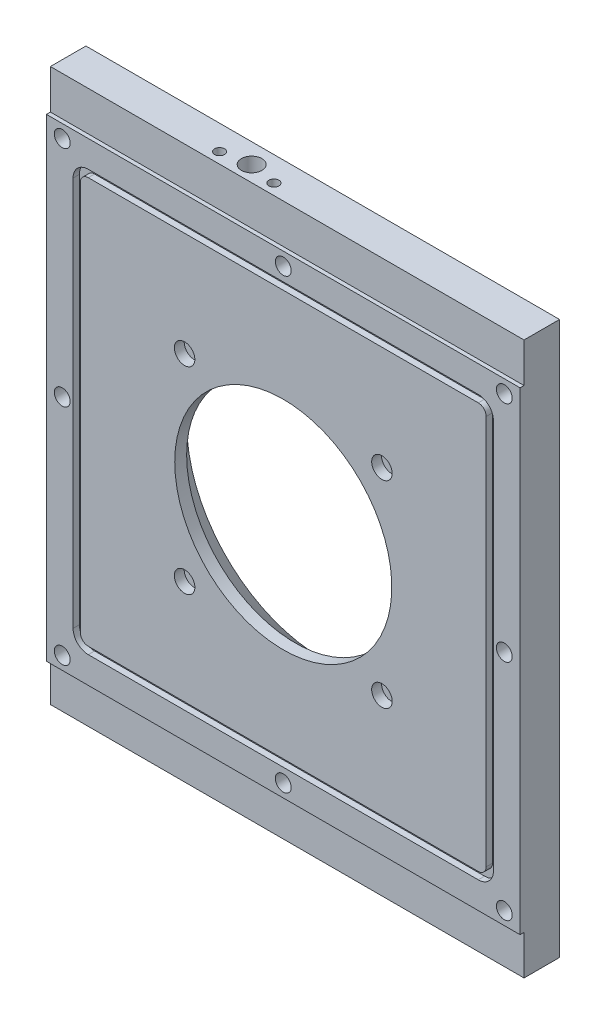
from build123d import *

# Parameters (mm, degrees)
SKETCH1_W                                       = 152.4
SKETCH1_H                                       = 177.8
BOSS_EXTRUDE1_DEPTH                             = 12.7
CUT_EXTRUDE5_START                              = -1.9304
CUT_EXTRUDE5_OUTLINE_W                          = 127
CUT_EXTRUDE5_OUTLINE_H                          = 127
CUT_EXTRUDE5_DEPTH                              = 1.9304
SKETCH7_W                                       = 102.9208
SKETCH7_H                                       = 102.9208
BOSS_EXTRUDE2_DEPTH                             = 1.9304
SKETCH9_W                                       = 34.925
SKETCH9_H                                       = 19.05
CBORE_FOR_10_SOCKET_HEAD_CAP_SCREW1_D           = 5.1054
CBORE_FOR_10_SOCKET_HEAD_CAP_SCREW1_CBORE_D     = 9.525
CBORE_FOR_10_SOCKET_HEAD_CAP_SCREW1_CBORE_DEPTH = 4.826
CBORE_FOR_10_SOCKET_HEAD_CAP_SCREW2_D           = 5.1054
CBORE_FOR_10_SOCKET_HEAD_CAP_SCREW2_CBORE_D     = 9.525
CBORE_FOR_10_SOCKET_HEAD_CAP_SCREW2_CBORE_DEPTH = 4.826
F_4_40_TAPPED_HOLE1_D                           = 2.2606
F_4_40_TAPPED_HOLE1_DEPTH                       = 7.5946
F_4_40_TAPPED_HOLE1_TIP                         = 0.679152758
SKETCH25_R                                      = 3.302
CUT_EXTRUDE7_DEPTH                              = 3.175
MIRROR2_COPY_1_SKETCH_R                         = 3.302
MIRROR2_COPY_1_DEPTH                            = 3.175
SKETCH26_W                                      = 152.4
SKETCH26_H                                      = 12.7
CUT_EXTRUDE8_DEPTH                              = 1.27
SKETCH30_R                                      = 1.6129
CUT_EXTRUDE12_DEPTH                             = 33.02
SKETCH31_R                                      = 3.302
CUT_EXTRUDE13_DEPTH                             = 40.64
CUT_EXTRUDE15_DEPTH                             = 2.032
SKETCH37_R                                      = 34.925
CUT_EXTRUDE18_DEPTH                             = 118.580133678
CHAMFER2_SIZE                                   = 8.8646
SKETCH38_W                                      = 127
SKETCH38_H                                      = 127
SKETCH38_W_2                                    = 102.9208
SKETCH38_H_2                                    = 102.9208
BOSS_EXTRUDE3_DEPTH                             = 1.9304


# Read off the part's stored shape, not the designer's step: Cut-Extrude5
with BuildPart() as part:
    # Sketch1 → Boss-Extrude1 (new body)
    with BuildSketch(Plane.XY.offset(12.7)):
        Rectangle(SKETCH1_W, SKETCH1_H)
    extrude(amount=-BOSS_EXTRUDE1_DEPTH)

    # Cut-Extrude5 outline → Cut-Extrude5 (cut)
    with BuildSketch(Plane.XY.offset(12.7).offset(CUT_EXTRUDE5_START)):
        Rectangle(CUT_EXTRUDE5_OUTLINE_W, CUT_EXTRUDE5_OUTLINE_H)
    extrude(amount=CUT_EXTRUDE5_DEPTH, mode=Mode.SUBTRACT)

    # Sketch7 → Boss-Extrude2 (add)
    with BuildSketch(Plane.XY.offset(10.7696)):
        Rectangle(SKETCH7_W, SKETCH7_H)
    extrude(amount=BOSS_EXTRUDE2_DEPTH)

    # Sketch9 → Cut-Revolve1 (revolve, cut)
    with BuildSketch(Plane.XZ, mode=Mode.PRIVATE) as cut_revolve1_sk:
        with Locations((17.4625, 11.4808)):
            Rectangle(SKETCH9_W, SKETCH9_H)
    revolve(cut_revolve1_sk.sketch.rotate(Axis((0, 0, 21.0058), (0, 0, -1)), 180), axis=Axis((0, 0, 21.0058), (0, 0, -1)), mode=Mode.SUBTRACT)

    # Sketch10 → Cut-Revolve2 (revolve, cut)
    with BuildSketch(Plane(origin=(-16.51, 0, 0), x_dir=(0, 0, -1), z_dir=(1, 0, 0))):
        Polygon((-6.35, 76.2), (-8.3165188, 76.2), (-7.718188123, 70.325851431), (-7.026590967, 70.325851431), (-7.026590967, 63.019039257), (-8.89, 62.746717258), (-8.89, 29.272053652), (-6.35, 29.272053652), align=None)
    revolve(axis=Axis((-16.51, 29.272053652, 6.35), (0, 1, 0)), mode=Mode.SUBTRACT)

    # CBORE for #10 Socket Head Cap Screw1 (through all)
    with Locations(Plane(origin=(0, 0, 0), x_dir=(-1, 0, 0), z_dir=(0, 0, -1))):
        with Locations((0, 72.009), (0, -72.009)):
            CounterBoreHole(CBORE_FOR_10_SOCKET_HEAD_CAP_SCREW1_D / 2, CBORE_FOR_10_SOCKET_HEAD_CAP_SCREW1_CBORE_D / 2, CBORE_FOR_10_SOCKET_HEAD_CAP_SCREW1_CBORE_DEPTH)

    # CBORE for #10 Socket Head Cap Screw2 (through all)
    with Locations(Plane(origin=(0, 0, 0), x_dir=(-1, 0, 0), z_dir=(0, 0, -1))):
        with Locations((71.12, 0), (71.12, -72.009), (71.12, 72.009)):
            cbore_for_10_socket_head_cap_screw2 = CounterBoreHole(CBORE_FOR_10_SOCKET_HEAD_CAP_SCREW2_D / 2, CBORE_FOR_10_SOCKET_HEAD_CAP_SCREW2_CBORE_D / 2, CBORE_FOR_10_SOCKET_HEAD_CAP_SCREW2_CBORE_DEPTH)

    # #4-40 Tapped Hole1
    with Locations(Plane.XY.offset(12.7)):
        with Locations((-31.75, 31.75), (31.75, 31.75), (31.75, -31.75), (-31.75, -31.75)):
            Hole(F_4_40_TAPPED_HOLE1_D / 2, depth=F_4_40_TAPPED_HOLE1_DEPTH)
            with Locations((0, 0, -(F_4_40_TAPPED_HOLE1_DEPTH + F_4_40_TAPPED_HOLE1_TIP / 2))):  # 118° drill point
                Cone(0, F_4_40_TAPPED_HOLE1_D / 2, F_4_40_TAPPED_HOLE1_TIP, mode=Mode.SUBTRACT)

    # Sketch25 → Cut-Extrude7 (cut)
    with BuildSketch(Plane.XY.offset(12.7)):
        with Locations((-31.75, 31.75)):
            Circle(SKETCH25_R)
    cut_extrude7 = extrude(amount=-CUT_EXTRUDE7_DEPTH, mode=Mode.SUBTRACT)

    # Mirror1: Cut-Extrude7 across plane
    add(cut_extrude7.mirror(Plane(origin=(0, 0, 0), x_dir=(0, 0, 1), z_dir=(1, 0, 0))), mode=Mode.SUBTRACT)

    # Mirror2: Cut-Extrude7 across plane
    add(cut_extrude7.mirror(Plane.ZX), mode=Mode.SUBTRACT)

    # Mirror2 copy 1 sketch → Mirror2 copy 1 (cut)
    with BuildSketch(Plane(origin=(0, 0, 12.7), x_dir=(-1, 0, 0), z_dir=(0, 0, 1))):
        with Locations((-31.75, 31.75)):
            Circle(MIRROR2_COPY_1_SKETCH_R)
    extrude(amount=-MIRROR2_COPY_1_DEPTH, mode=Mode.SUBTRACT)

    # Sketch26 → Cut-Extrude8 (cut)
    with BuildSketch(Plane.XY.offset(12.7)):
        with Locations((0, 82.55)):
            Rectangle(SKETCH26_W, SKETCH26_H)
    cut_extrude8 = extrude(amount=-CUT_EXTRUDE8_DEPTH, mode=Mode.SUBTRACT)

    # Mirror4: Cut-Extrude8 across plane
    add(cut_extrude8.mirror(Plane.ZX), mode=Mode.SUBTRACT)

    # Sketch30 → Cut-Extrude12 (cut)
    with BuildSketch(Plane(origin=(0, 88.9, 0), x_dir=(1, 0, 0), z_dir=(0, 1, 0))):
        with Locations(Location((-7.762889406, -7.9375, 0), (0, 0, 270))):
            Circle(SKETCH30_R)
        with Locations(Location((-25.257110594, -7.9375, 0), (0, 0, 270))):
            Circle(SKETCH30_R)
    extrude(amount=-CUT_EXTRUDE12_DEPTH, mode=Mode.SUBTRACT)

    # Sketch31 → Cut-Extrude13 (cut)
    with BuildSketch(Plane(origin=(0, 88.9, 0), x_dir=(1, 0, 0), z_dir=(0, 1, 0))):
        with Locations(Location((-16.51, -6.35, 0), (0, 0, 270))):
            Circle(SKETCH31_R)
    extrude(amount=-CUT_EXTRUDE13_DEPTH, mode=Mode.SUBTRACT)

    # Mirror7: CBORE for #10 Socket Head Cap Screw2 across plane
    add(cbore_for_10_socket_head_cap_screw2.mirror(Plane(origin=(0, 0, 0), x_dir=(0, 0, 1), z_dir=(1, 0, 0))), mode=Mode.SUBTRACT)

    # Sketch33 → Cut-Extrude15 (cut)
    with BuildSketch(Plane(origin=(0, 0, 12.7), x_dir=(-1, 0, 0), z_dir=(0, 0, -1))):
        with BuildLine():
            Line((-62.7507, 67.6275), (62.7507, 67.6275))
            ThreePointArc((62.7507, 67.6275), (66.19911835, 66.19911835), (67.6275, 62.7507))
            Line((67.6275, 62.7507), (67.6275, -62.7507))
            ThreePointArc((67.6275, -62.7507), (66.19911835, -66.19911835), (62.7507, -67.6275))
            Line((62.7507, -67.6275), (-62.7507, -67.6275))
            ThreePointArc((-62.7507, -67.6275), (-66.19911835, -66.19911835), (-67.6275, -62.7507))
            Line((-67.6275, -62.7507), (-67.6275, 62.7507))
            ThreePointArc((-67.6275, 62.7507), (-66.19911835, 66.19911835), (-62.7507, 67.6275))
        make_face()
        with BuildLine():
            Line((-62.7507, 65.2907), (62.7507, 65.2907))
            ThreePointArc((62.7507, 65.2907), (64.546751224, 64.546751224), (65.2907, 62.7507))
            Line((65.2907, 62.7507), (65.2907, -62.7507))
            ThreePointArc((65.2907, -62.7507), (64.546751224, -64.546751224), (62.7507, -65.2907))
            Line((62.7507, -65.2907), (-62.7507, -65.2907))
            ThreePointArc((-62.7507, -65.2907), (-64.546751224, -64.546751224), (-65.2907, -62.7507))
            Line((-65.2907, -62.7507), (-65.2907, 62.7507))
            ThreePointArc((-65.2907, 62.7507), (-64.546751224, 64.546751224), (-62.7507, 65.2907))
        make_face(mode=Mode.SUBTRACT)
    extrude(amount=CUT_EXTRUDE15_DEPTH, mode=Mode.SUBTRACT)

    # Sketch37 → Cut-Extrude18 (cut, through all)
    with BuildSketch(Plane.XY.offset(1.9558)):
        with Locations(Location((0, 0, 0), (0, 0, 180))):
            Circle(SKETCH37_R)
    extrude(amount=-CUT_EXTRUDE18_DEPTH, mode=Mode.SUBTRACT)

    # Chamfer2
    # the kernel refuses this chamfer: 8.8646 mm, written as the material it takes off along each edge
    with BuildSketch(Plane(origin=(0, 0, 0), x_dir=(-1, 0, 0), z_dir=(0, 1, 0))) as chamfer2_piece_1:
        Polygon((34.925 + CHAMFER2_SIZE, 0), (34.925, CHAMFER2_SIZE), (34.925, 0), align=None)
    revolve(axis=Axis((0, 0, 0), (0, 0, 1)), mode=Mode.SUBTRACT)

    # Sketch38 → Boss-Extrude3 (add)
    with BuildSketch(Plane.XY.offset(10.7696)):
        Rectangle(SKETCH38_W, SKETCH38_H)
        Rectangle(SKETCH38_W_2, SKETCH38_H_2, mode=Mode.SUBTRACT)
    extrude(amount=BOSS_EXTRUDE3_DEPTH)


solid = part.part
